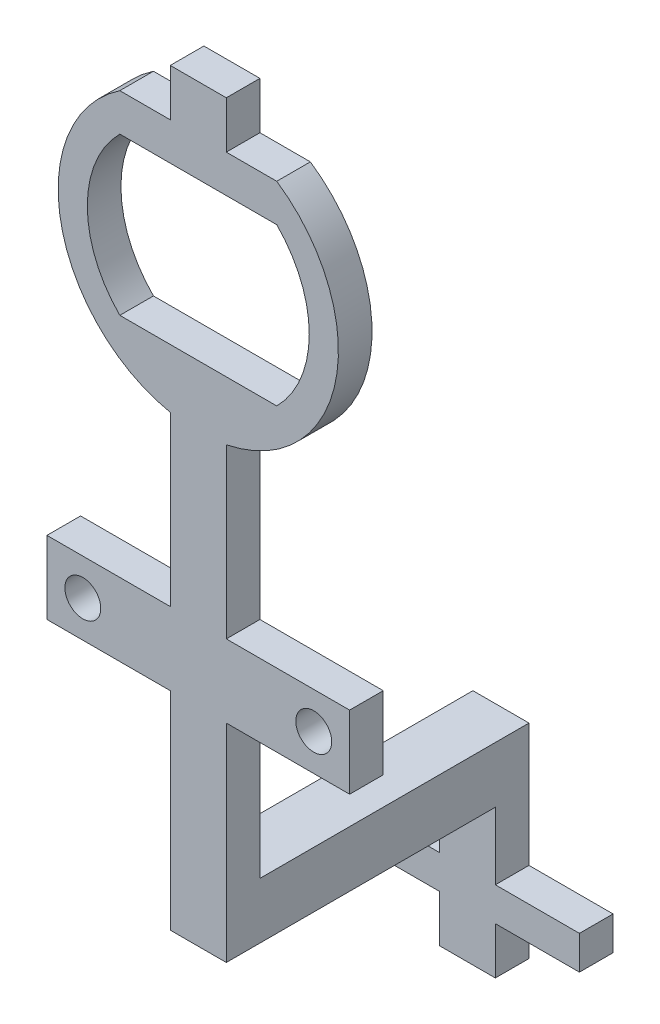
from build123d import *

# Parameters (mm, degrees)
BOSS_EXTRUDE1_DEPTH = 3
SKETCH3_W           = 27
SKETCH3_H           = 6.5
SKETCH3_R           = 1.6
BOSS_EXTRUDE4_DEPTH = 3
SKETCH4_W           = 5
SKETCH4_H           = 3
BOSS_EXTRUDE3_DEPTH = 4.2
SKETCH6_W           = 5
SKETCH6_H           = 5
BOSS_EXTRUDE5_DEPTH = 24
BOSS_EXTRUDE6_DEPTH = 3


with BuildPart() as part:
    # Sketch1 → Boss-Extrude1 (new body)
    with BuildSketch(Plane.XY):
        with BuildLine():
            Line((7, 10.356157589), (-7, 10.356157589))
            ThreePointArc((-7, 10.356157589), (-12.259414932, -2.440644491), (-2.5, -12.247448714))
            Line((-2.5, -12.247448714), (-2.5, -52.247448714))
            Line((-2.5, -52.247448714), (2.5, -52.247448714))
            Line((2.5, -52.247448714), (2.5, -12.247448714))
            ThreePointArc((2.5, -12.247448714), (12.259414932, -2.440644491), (7, 10.356157589))
        make_face()
        with BuildLine():
            ThreePointArc((-7, -7.000714249), (-9.9, 0), (-7, 7.000714249))
            Line((-7, 7.000714249), (7, 7.000714249))
            ThreePointArc((7, 7.000714249), (9.9, 0), (7, -7.000714249))
            Line((7, -7.000714249), (2.385585767, -7.000714249))
            Line((2.385585767, -7.000714249), (-2.5, -7.000714249))
            Line((-2.5, -7.000714249), (-7, -7.000714249))
        make_face(mode=Mode.SUBTRACT)
    extrude(amount=BOSS_EXTRUDE1_DEPTH)

    # Sketch3 → Boss-Extrude4 (add)
    with BuildSketch(Plane.XY):
        with Locations((0, -30.497448714)):
            Rectangle(SKETCH3_W, SKETCH3_H)
        with Locations((-10.3, -30.497448714)):
            Circle(SKETCH3_R, mode=Mode.SUBTRACT)
        with Locations((10.3, -30.497448714)):
            Circle(SKETCH3_R, mode=Mode.SUBTRACT)
    extrude(amount=BOSS_EXTRUDE4_DEPTH)

    # Sketch4 → Boss-Extrude3 (add)
    with BuildSketch(Plane(origin=(0, 10.356157589, 0), x_dir=(1, 0, 0), z_dir=(0, 1, 0))):
        with Locations((0, -1.5)):
            Rectangle(SKETCH4_W, SKETCH4_H)
    extrude(amount=BOSS_EXTRUDE3_DEPTH)

    # Sketch6 → Boss-Extrude5 (add)
    with BuildSketch(Plane(origin=(0, 0, 0), x_dir=(-1, 0, 0), z_dir=(0, 0, -1))):
        with Locations((0, -49.747448714)):
            Rectangle(SKETCH6_W, SKETCH6_H)
    extrude(amount=BOSS_EXTRUDE5_DEPTH)

    # Sketch9 → Boss-Extrude6 (add)
    with BuildSketch(Plane(origin=(0, 0, -24), x_dir=(-1, 0, 0), z_dir=(0, 0, -1))):
        Polygon((2.5, -61.243842411), (2.5, -65.443842411), (-2.5, -65.443842411), (-2.5, -61.243842411), (-10, -61.243842411), (-10, -58.243842411), (-2.5, -58.243842411), (-2.5, -52.247448714), (2.5, -52.247448714), (2.5, -58.243842411), (10, -58.243842411), (10, -61.243842411), align=None)
    extrude(amount=-BOSS_EXTRUDE6_DEPTH)


solid = part.part
